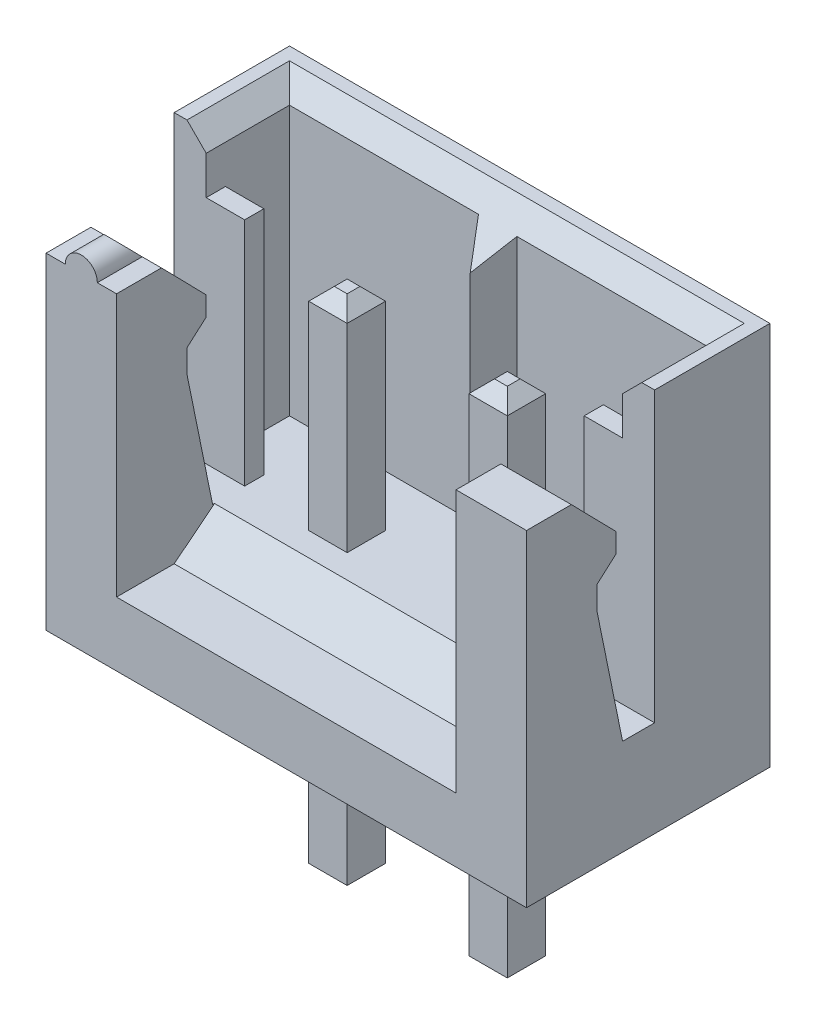
from build123d import *

# Parameters (mm, degrees)
SKETCH_1_W                         = 7.5
SKETCH_1_H                         = 3.8
EXTRUDE_1_DEPTH                    = 6
CUT_EXTRUDE_1_DEPTH                = 5
CUT_EXTRUDE_2_DEPTH                = 11.329085148
EXTRUDE_2_REACH                    = 12.329
CUT_EXTRUDE_3_REACH                = 12.329
SKETCH_5_W                         = 5.3
SKETCH_5_H                         = 4.1
EXTRUDE_3_REACH                    = 11.972
EXTRUDE_5_REACH                    = 12.329
SKETCH_11_W                        = 2
SKETCH_11_H                        = 3.2
SKETCH_11_W_2                      = 0.8
SKETCH_11_H_2                      = 0.8
CUT_EXTRUDE_5_DEPTH                = 0.3
SKETCH_15_R                        = 0.05
CUT_EXTRUDE_6_DEPTH                = 0.1
CHAMFER_7_SIZE                     = 0.3
EXTRUDE_START                      = -4.8
SKETCH_7_W                         = 0.6
SKETCH_7_H                         = 0.6
EXTRUDE_4_DEPTH                    = 8
CHAMFER_6_SIZE                     = 0.2
PATTERN_LINEAR_1_COUNT             = 2
PATTERN_LINEAR_1_PITCH             = 2.5
CHAMFER_7_OF_PATTERN_LINEAR_1_SIZE = 0.3
CHAMFER_6_OF_PATTERN_LINEAR_1_SIZE = 0.2
CUT_EXTRUDE_4_REACH                = 11.972
CHAMFER_5_SIZE                     = 0.3


with BuildPart() as part:
    # Эскиз1 → Бобышка-Вытянуть1 (new body)
    with BuildSketch(Plane(origin=(0, 0, 0), x_dir=(1, 0, 0), z_dir=(0, 1, 0))):
        with Locations((3.75, -1.9)):
            Rectangle(SKETCH_1_W, SKETCH_1_H)
    extrude(amount=EXTRUDE_1_DEPTH)

    # Эскиз2 → Вырез-Вытянуть1 (cut)
    with BuildSketch(Plane(origin=(0, 6, 0), x_dir=(1, 0, 0), z_dir=(0, 1, 0))):
        Polygon((0.5, -0.5), (7, -0.5), (7, -1.5), (6.4, -1.5), (6.4, -3.3), (1.1, -3.3), (1.1, -1.5), (0.5, -1.5), align=None)
    extrude(amount=-CUT_EXTRUDE_1_DEPTH, mode=Mode.SUBTRACT)

    # Эскиз3 → Вырез-Вытянуть2 (cut, through all)
    with BuildSketch(Plane.ZY):
        Polygon((1.8, 6), (1.8, 1.5), (2.3, 1.5), (2.7, 3.459591794), (2.7, 3.821282026), (2.4, 4.085857157), (2.4, 4.385857157), (3.1, 5.1), (3.8, 5.1), (3.8, 6), align=None)
    extrude(amount=-CUT_EXTRUDE_2_DEPTH, mode=Mode.SUBTRACT)

    # Бобышка-Вытянуть2: up to this plane
    extrude_2_end = Plane(origin=(7.5, 5.1, 3.1), z_dir=(0, -0.6999999999999996, 0.7141428428542854))
    # Эскиз4 → Бобышка-Вытянуть2 (add, up to the surface)
    with BuildSketch(Plane.XY.offset(3.8), mode=Mode.PRIVATE) as extrude_2_sk1:
        with BuildLine():
            Line((0.3, 5.1), (0.8, 5.1))
            ThreePointArc((0.8, 5.1), (0.55, 5.35), (0.3, 5.1))
        make_face()
    extrude_2_tool1 = split(extrude(extrude_2_sk1.sketch, amount=-EXTRUDE_2_REACH, mode=Mode.PRIVATE), bisect_by=extrude_2_end, keep=Keep.BOTH, mode=Mode.PRIVATE)
    add(extrude_2_tool1.solids().sort_by_distance((0.55, 5.206103, 3.8))[0])

    # Эскиз5 → Вырез-Вытянуть3 (cut, up to next)
    with BuildSketch(Plane.XY.offset(3.8), mode=Mode.PRIVATE) as cut_extrude_3_sk1:
        with Locations((3.75, 3.05)):
            Rectangle(SKETCH_5_W, SKETCH_5_H)
    cut_extrude_3_tool1 = extrude(cut_extrude_3_sk1.sketch, amount=-CUT_EXTRUDE_3_REACH, mode=Mode.PRIVATE) & part.part
    add(cut_extrude_3_tool1.solids().sort_by_distance((3.75, 3.05, 3.8))[0], mode=Mode.SUBTRACT)

    # Эскиз6 → Бобышка-Вытянуть3 (add, up to next)
    with BuildSketch(Plane(origin=(0.5, 0, 0), x_dir=(0, 0, -1), z_dir=(1, 0, 0)), mode=Mode.PRIVATE) as extrude_3_sk1:
        Polygon((-2.9, 1), (-2.27, 1.5), (-0.5, 1.5), (-0.5, 1), align=None)
    extrude_3_tool1 = extrude(extrude_3_sk1.sketch, amount=EXTRUDE_3_REACH, mode=Mode.PRIVATE) - part.part
    add(extrude_3_tool1.solids().sort_by_distance((0.5, 1.23741, 1.550432))[0])

    # Эскиз9 → Бобышка-Вытянуть5 (add, up to next)
    with BuildSketch(Plane(origin=(0, 6, 0), x_dir=(1, 0, 0), z_dir=(0, 1, 0)), mode=Mode.PRIVATE) as extrude_5_sk1:
        Polygon((3.45, -0.5), (3.75, -0.928444402), (4.05, -0.5), align=None)
    extrude_5_tool1 = extrude(extrude_5_sk1.sketch, amount=-EXTRUDE_5_REACH, mode=Mode.PRIVATE) - part.part
    add(extrude_5_tool1.solids().sort_by_distance((3.75, 6, 0.642815))[0])

    # Эскиз11 → Вырез-Вытянуть5 (cut)
    with BuildSketch(Plane.XZ):
        with Locations((2.5, 1.6)):
            Rectangle(SKETCH_11_W, SKETCH_11_H)
        with Locations((2.5, 1.6)):
            Rectangle(SKETCH_11_W_2, SKETCH_11_H_2, mode=Mode.SUBTRACT)
    cut_extrude_5 = extrude(amount=-CUT_EXTRUDE_5_DEPTH, mode=Mode.SUBTRACT)

    # Эскиз15 → Вырез-Вытянуть6 (cut)
    with BuildSketch(Plane.XZ):
        with Locations(Location((2.5, 1.6, 0), (0, 0, 270))):
            Circle(SKETCH_15_R)
    extrude(amount=-CUT_EXTRUDE_6_DEPTH, mode=Mode.SUBTRACT)

    # Фаска7
    chamfer_7_edges = [part.edges().sort_by_distance(p)[0] for p in [
        (1.5, 0.3, 1.6),
        (2.5, 0.3, 3.2),
        (3.5, 0.3, 1.6),
        (2.9, 0.3, 1.6),
        (2.5, 0.3, 2),
        (2.1, 0.3, 1.6),
        (2.5, 0.3, 1.2),
    ]]
    chamfer(chamfer_7_edges, length=CHAMFER_7_SIZE - 0.0001)  # a hair under: the kernel refuses the full size

    # Эскиз7 → Бобышка-Вытянуть4 (add)
    with BuildSketch(Plane.XZ.offset(EXTRUDE_START)):
        with Locations((2.5, 1.6)):
            Rectangle(SKETCH_7_W, SKETCH_7_H)
    extrude_4 = extrude(amount=EXTRUDE_4_DEPTH)

    # Фаска6
    chamfer_6_edges = [part.edges().sort_by_distance(p)[0] for p in [
        (2.8, 4.8, 1.6),
        (2.5, 4.8, 1.9),
        (2.2, 4.8, 1.6),
        (2.5, 4.8, 1.3),
        (2.8, -3.2, 1.6),
        (2.5, -3.2, 1.9),
        (2.2, -3.2, 1.6),
        (2.5, -3.2, 1.3),
    ]]
    chamfer(chamfer_6_edges, length=CHAMFER_6_SIZE)

    # Линейный массив1: Вырез-Вытянуть5, Бобышка-Вытянуть4 ×2
    with Locations(*[(i * PATTERN_LINEAR_1_PITCH, 0, 0) for i in range(1, PATTERN_LINEAR_1_COUNT)]):
        add(cut_extrude_5, mode=Mode.SUBTRACT)
        add(extrude_4)

    # Фаска7 of Линейный массив1
    chamfer_7_of_pattern_linear_1_edges = [part.edges().sort_by_distance(p)[0] for p in [
        (4, 0.3, 1.6),
        (5, 0.3, 3.2),
        (6, 0.3, 1.6),
        (5.4, 0.3, 1.6),
        (5, 0.3, 2),
        (4.6, 0.3, 1.6),
        (5, 0.3, 1.2),
    ]]
    chamfer(chamfer_7_of_pattern_linear_1_edges, length=CHAMFER_7_OF_PATTERN_LINEAR_1_SIZE - 0.0001)  # a hair under: the kernel refuses the full size

    # Фаска6 of Линейный массив1
    chamfer_6_of_pattern_linear_1_edges = [part.edges().sort_by_distance(p)[0] for p in [
        (5.3, 4.8, 1.6),
        (5, 4.8, 1.9),
        (4.7, 4.8, 1.6),
        (5, 4.8, 1.3),
        (5.3, -3.2, 1.6),
        (5, -3.2, 1.9),
        (4.7, -3.2, 1.6),
        (5, -3.2, 1.3),
    ]]
    chamfer(chamfer_6_of_pattern_linear_1_edges, length=CHAMFER_6_OF_PATTERN_LINEAR_1_SIZE)

    # Вырез-Вытянуть4: up to this face of the body (flat: up to its plane)
    cut_extrude_4_end = Plane(part.part.faces().sort_by_distance((7, 3.75, 1))[0])
    # Эскиз10 → Вырез-Вытянуть4 (cut, up to the picked face)
    with BuildSketch(Plane(origin=(0.5, 0, 0), x_dir=(0, 0, -1), z_dir=(1, 0, 0)), mode=Mode.PRIVATE) as cut_extrude_4_sk1:
        Polygon((-1, 6), (-0.2, 6), (-1, 5.2), (-1, 5.1), (-1.8, 5.1), (-1.8, 6), align=None)
    cut_extrude_4_tool1 = split(extrude(cut_extrude_4_sk1.sketch, amount=CUT_EXTRUDE_4_REACH, mode=Mode.PRIVATE), bisect_by=cut_extrude_4_end, keep=Keep.BOTH, mode=Mode.PRIVATE)
    add(cut_extrude_4_tool1.solids().sort_by(Axis((0.5, 5.60641, 1.194872), (1, 0, 0)))[0], mode=Mode.SUBTRACT)

    # Фаска5
    chamfer_5_edges = [part.edges().sort_by_distance(p)[0] for p in [
        (7, 6, 1),
        (0.5, 6, 1),
    ]]
    chamfer(chamfer_5_edges, length=CHAMFER_5_SIZE)


solid = part.part
